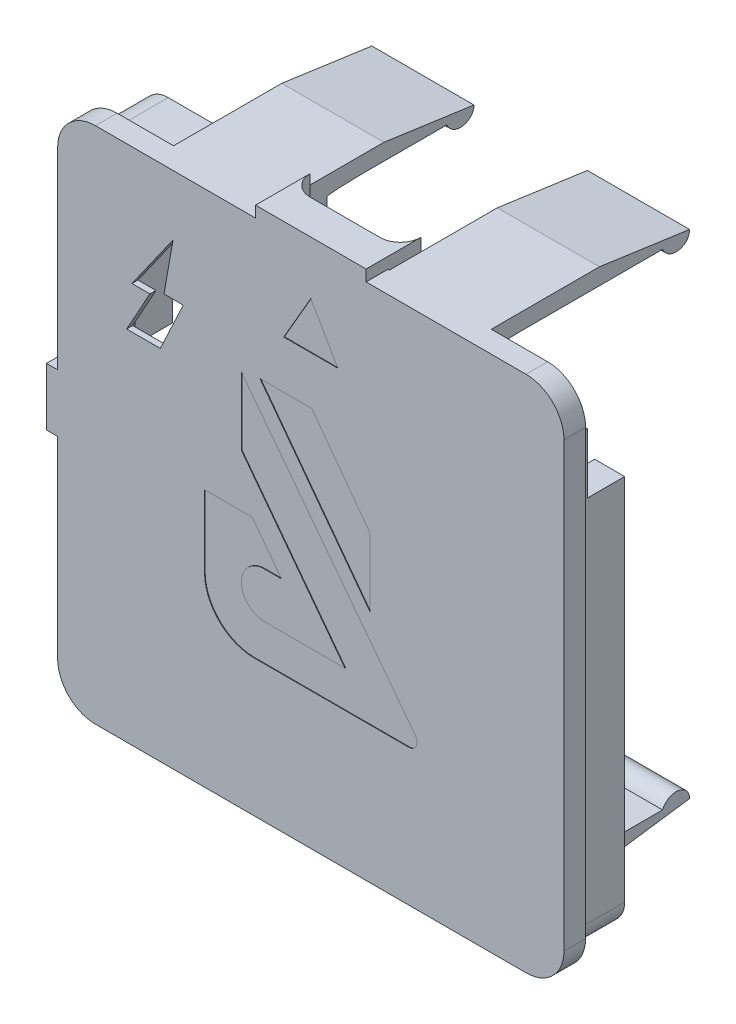
from build123d import *

# Parameters (mm, degrees)
COVER_BASE_DEPTH                             = 1.2
COVER_LIP_DEPTH                              = 0.6
TRIANGLE_INDICATOR_DEPTH                     = 0.05
CHARGE_INDICATOR_HOLE_DEPTH                  = 1.2
LIGHT_PIPE_CUTOUT_SKETCH_W                   = 6.042496398
LIGHT_PIPE_CUTOUT_SKETCH_H                   = 10.123586628
LIGHT_PIPE_CUTOUT_DEPTH                      = 0.7
CHARGE_PORT_SUPPORT_DEPTH                    = 1
POWER_SWITCH_SUPPORT_SKETCH_W                = 0.4
POWER_SWITCH_SUPPORT_SKETCH_H                = 4.8
POWER_SWITCH_SUPPORT_DEPTH                   = 1
INNER_USB_SUPPORT_SKETCH_W                   = 5.8
INNER_USB_SUPPORT_SKETCH_H                   = 6.566666667
INNER_USB_SUPPORT_DEPTH                      = 1.65
OUTER_START                                  = 0.933333333
OUTER_USB_KEY_DEPTH                          = 0.933333333
OUTER_SWITCH_KEY_SKETCH_W                    = 2.2
OUTER_SWITCH_KEY_SKETCH_H                    = 4.8
OUTER_SWITCH_KEY_DEPTH                       = 0.933333333
BATT_CONNECTOR_HOLDER_DEPTH                  = 1.75
MAIN_PCB_SUPPORT_DEPTH                       = 4.85
CLIP_START                                   = -1.8
CLIP_BODY_SKETCH_W                           = 8.5
CLIP_BODY_SKETCH_H                           = 1.366666667
CLIP_BODY_DEPTH                              = 18.3
CLIP_EDGE_DEPTH                              = 8.5
CLIP_SHAVE_DEPTH                             = 8.5
ROUNDING_SHAVE_DEPTH                         = 8.5
CLIP_MIRROR_AT_THE_SECOND_PLANE_COPY_1_S_W   = 8.5
CLIP_MIRROR_AT_THE_SECOND_PLANE_COPY_1_S_H   = 1.366666667
CLIP_MIRROR_AT_THE_SECOND_PLANE_COPY_1_DEPTH = 18.3
CLIP_MIRROR_AT_THE_SECOND_PLANE_COPY_2_DEPTH = 8.5
CLIP_MIRROR_AT_THE_SECOND_PLANE_COPY_3_DEPTH = 8.5
CLIP_MIRROR_AT_THE_SECOND_PLANE_COPY_4_DEPTH = 8.5
CLIP_START_2                                 = -13.22
CLIP_REINFORCEMENT_FILLETS_DEPTH             = 6.3
CLIP_START_3                                 = 6.92
CLIP_REINFORCEMENT_FILLETS_2_DEPTH           = 6.3
CLIP_START_4                                 = -12.34671
CLIP_REINFORCEMENT_FILLETS_3_DEPTH           = 7.62671
CLIP_START_5                                 = 4.72
CLIP_REINFORCEMENT_FILLETS_4_DEPTH           = 7.62671
PRINTED_LOGO_DEPTH                           = 0.05


with BuildPart() as part:
    # Cover Base Sketch → Cover Base (new body)
    with BuildSketch(Plane.XY):
        with BuildLine():
            Line((-21.066666667, -18.416666667), (-21.066666667, 18.416666667))
            ThreePointArc((-21.066666667, 18.416666667), (-20.144053027, 20.644053027), (-17.916666667, 21.566666667))
            Line((-17.916666667, 21.566666667), (17.916666667, 21.566666667))
            ThreePointArc((17.916666667, 21.566666667), (20.144053027, 20.644053027), (21.066666667, 18.416666667))
            Line((21.066666667, 18.416666667), (21.066666667, -18.416666667))
            ThreePointArc((21.066666667, -18.416666667), (20.144053027, -20.644053027), (17.916666667, -21.566666667))
            Line((17.916666667, -21.566666667), (-17.916666667, -21.566666667))
            ThreePointArc((-17.916666667, -21.566666667), (-20.144053027, -20.644053027), (-21.066666667, -18.416666667))
        make_face()
    extrude(amount=-COVER_BASE_DEPTH)

    # Cover lip sketch → Cover Lip (add)
    with BuildSketch(Plane(origin=(0, 0, -1.2), x_dir=(-1, 0, 0), z_dir=(0, 0, -1))):
        with BuildLine():
            Line((-21.066666667, 18.416666667), (-21.066666667, -18.416666667))
            ThreePointArc((-21.066666667, -18.416666667), (-20.144053027, -20.644053027), (-17.916666667, -21.566666667))
            Line((-17.916666667, -21.566666667), (17.916666667, -21.566666667))
            ThreePointArc((17.916666667, -21.566666667), (20.144053027, -20.644053027), (21.066666667, -18.416666667))
            Line((21.066666667, -18.416666667), (21.066666667, 18.416666667))
            ThreePointArc((21.066666667, 18.416666667), (20.144053027, 20.644053027), (17.916666667, 21.566666667))
            Line((17.916666667, 21.566666667), (-17.916666667, 21.566666667))
            ThreePointArc((-17.916666667, 21.566666667), (-20.144053027, 20.644053027), (-21.066666667, 18.416666667))
        make_face()
        with BuildLine():
            Line((17.916666667, 20.566666667), (-17.916666667, 20.566666667))
            ThreePointArc((-17.916666667, 20.566666667), (-19.436946246, 19.936946246), (-20.066666667, 18.416666667))
            Line((-20.066666667, 18.416666667), (-20.066666667, -18.416666667))
            ThreePointArc((-20.066666667, -18.416666667), (-19.436946246, -19.936946246), (-17.916666667, -20.566666667))
            Line((-17.916666667, -20.566666667), (17.916666667, -20.566666667))
            ThreePointArc((17.916666667, -20.566666667), (19.436946246, -19.936946246), (20.066666667, -18.416666667))
            Line((20.066666667, -18.416666667), (20.066666667, 18.416666667))
            ThreePointArc((20.066666667, 18.416666667), (19.436946246, 19.936946246), (17.916666667, 20.566666667))
        make_face(mode=Mode.SUBTRACT)
    extrude(amount=COVER_LIP_DEPTH)

    # Triangle Indicator Sketch → Triangle Indicator (cut)
    with BuildSketch(Plane.XY):
        Polygon((2.25, 14.16955235), (-2.25, 14.16955235), (0, 18.066666667), align=None)
    extrude(amount=-TRIANGLE_INDICATOR_DEPTH, mode=Mode.SUBTRACT)

    # Charge Indicator Hole Sketch → Charge Indicator Hole (cut)
    with BuildSketch(Plane.XY):
        Polygon((-12.521248199, 8.211793314), (-15.321248199, 8.211793314), (-13.384756526, 11.711793314), (-14.884756526, 11.711793314), (-11.461694847, 16.561793314), (-12.215243474, 12.288206686), (-10.615243474, 12.288206686), align=None)
    extrude(amount=-CHARGE_INDICATOR_HOLE_DEPTH, mode=Mode.SUBTRACT)

    # Light Pipe Cutout Sketch → Light Pipe Cutout (cut)
    with BuildSketch(Plane(origin=(0, 0, -1.2), x_dir=(-1, 0, 0), z_dir=(0, 0, -1))):
        with Locations((12.8, 12)):
            Rectangle(LIGHT_PIPE_CUTOUT_SKETCH_W, LIGHT_PIPE_CUTOUT_SKETCH_H)
    extrude(amount=-LIGHT_PIPE_CUTOUT_DEPTH, mode=Mode.SUBTRACT)

    # Charge Port Support Sketch → Charge Port Support (add)
    with BuildSketch(Plane(origin=(0, 21.566666667, 0), x_dir=(1, 0, 0), z_dir=(0, 1, 0))):
        with BuildLine():
            Line((4.6, 4.55), (4.6, 1.8))
            Line((4.6, 1.8), (-4.6, 1.8))
            Line((-4.6, 1.8), (-4.6, 4.55))
            ThreePointArc((-4.6, 4.55), (-4.102081528, 3.347918472), (-2.9, 2.85))
            Line((-2.9, 2.85), (2.9, 2.85))
            ThreePointArc((2.9, 2.85), (4.102081528, 3.347918472), (4.6, 4.55))
        make_face()
    extrude(amount=-CHARGE_PORT_SUPPORT_DEPTH)

    # Power Switch Support Sketch → Power Switch Support (add)
    with BuildSketch(Plane.ZY.offset(21.066666667)):
        with Locations((-2, 0)):
            Rectangle(POWER_SWITCH_SUPPORT_SKETCH_W, POWER_SWITCH_SUPPORT_SKETCH_H)
    extrude(amount=-POWER_SWITCH_SUPPORT_DEPTH)

    # Inner USB Support Sketch → Inner USB Support (add)
    with BuildSketch(Plane(origin=(0, 0, -1.2), x_dir=(-1, 0, 0), z_dir=(0, 0, -1))):
        with Locations((0, 17.283333333)):
            Rectangle(INNER_USB_SUPPORT_SKETCH_W, INNER_USB_SUPPORT_SKETCH_H)
    extrude(amount=INNER_USB_SUPPORT_DEPTH)

    # Outer USB Key Sketch → Outer USB Key (add)
    with BuildSketch(Plane(origin=(0, 21.566666667, 0), x_dir=(1, 0, 0), z_dir=(0, 1, 0)).offset(OUTER_START)):
        with BuildLine():
            Line((-4.6, 4.55), (-4.6, 1.8))
            Line((-4.6, 1.8), (-4.6, 0))
            Line((-4.6, 0), (4.6, 0))
            Line((4.6, 0), (4.6, 1.8))
            Line((4.6, 1.8), (4.6, 4.55))
            ThreePointArc((4.6, 4.55), (4.102081528, 3.347918472), (2.9, 2.85))
            Line((2.9, 2.85), (-2.9, 2.85))
            ThreePointArc((-2.9, 2.85), (-4.102081528, 3.347918472), (-4.6, 4.55))
        make_face()
    extrude(amount=-OUTER_USB_KEY_DEPTH)

    # Outer Switch Key Sketch → Outer Switch Key (add)
    with BuildSketch(Plane.ZY.offset(21.066666667)):
        with Locations((-1.1, 0)):
            Rectangle(OUTER_SWITCH_KEY_SKETCH_W, OUTER_SWITCH_KEY_SKETCH_H)
    extrude(amount=OUTER_SWITCH_KEY_DEPTH)

    # Batt Connector Holder Sketch → Batt Connector Holder (add)
    with BuildSketch(Plane(origin=(0, 0, -1.2), x_dir=(-1, 0, 0), z_dir=(0, 0, -1))):
        Polygon((-14.875, 17.25), (-19.375, 17.25), (-20.066666667, 17.25), (-20.066666667, 12.25), (-19.375, 12.25), (-14.875, 12.25), align=None)
    extrude(amount=BATT_CONNECTOR_HOLDER_DEPTH)

    # Main PCB Support Sketch → Main PCB Support (add)
    with BuildSketch(Plane(origin=(0, 0, -1.2), x_dir=(-1, 0, 0), z_dir=(0, 0, -1))):
        with BuildLine():
            Line((17.566666667, -4.495), (17.566666667, -15.916666667))
            ThreePointArc((17.566666667, -15.916666667), (16.936946246, -17.436946246), (15.416666667, -18.066666667))
            Line((15.416666667, -18.066666667), (6.92, -18.066666667))
            Line((6.92, -18.066666667), (6.92, -20.566666667))
            Line((6.92, -20.566666667), (17.916666667, -20.566666667))
            ThreePointArc((17.916666667, -20.566666667), (19.436946246, -19.936946246), (20.066666667, -18.416666667))
            Line((20.066666667, -18.416666667), (20.066666667, -4.495))
            Line((20.066666667, -4.495), (17.566666667, -4.495))
        make_face()
        with BuildLine():
            Line((17.566666667, 4.495), (20.066666667, 4.495))
            Line((20.066666667, 4.495), (20.066666667, 18.416666667))
            ThreePointArc((20.066666667, 18.416666667), (19.436946246, 19.936946246), (17.916666667, 20.566666667))
            Line((17.916666667, 20.566666667), (4.72, 20.566666667))
            Line((4.72, 20.566666667), (4.72, 18.066666667))
            Line((4.72, 18.066666667), (15.416666667, 18.066666667))
            ThreePointArc((15.416666667, 18.066666667), (16.936946246, 17.436946246), (17.566666667, 15.916666667))
            Line((17.566666667, 15.916666667), (17.566666667, 4.495))
        make_face()
        with BuildLine():
            Line((-20.066666667, 12.25), (-17.566666667, 12.25))
            Line((-17.566666667, 12.25), (-17.566666667, -15.916666667))
            ThreePointArc((-17.566666667, -15.916666667), (-16.936946246, -17.436946246), (-15.416666667, -18.066666667))
            Line((-15.416666667, -18.066666667), (-6.92, -18.066666667))
            Line((-6.92, -18.066666667), (-6.92, -20.566666667))
            Line((-6.92, -20.566666667), (-17.916666667, -20.566666667))
            ThreePointArc((-17.916666667, -20.566666667), (-19.436946246, -19.936946246), (-20.066666667, -18.416666667))
            Line((-20.066666667, -18.416666667), (-20.066666667, 12.25))
        make_face()
    extrude(amount=MAIN_PCB_SUPPORT_DEPTH)

    # Clip Body Sketch → Clip Body (add)
    with BuildSketch(Plane(origin=(0, 0, -1.8), x_dir=(-1, 0, 0), z_dir=(0, 0, -1)).offset(CLIP_START)):
        with Locations((8.97, 20.883333334)):
            Rectangle(CLIP_BODY_SKETCH_W, CLIP_BODY_SKETCH_H)
    clip_body = extrude(amount=CLIP_BODY_DEPTH)

    # Clip Edge Sketch → Clip Edge (add)
    with BuildSketch(Plane(origin=(-4.72, 0, 0), x_dir=(0, 0, -1), z_dir=(1, 0, 0))):
        with BuildLine():
            Line((18.3, 20.2), (16.05, 20.2))
            ThreePointArc((16.05, 20.2), (17.175, 19.45), (18.3, 20.2))
        make_face()
    clip_edge = extrude(amount=-CLIP_EDGE_DEPTH)

    # Clip shave sketch → Clip shave (cut)
    with BuildSketch(Plane.ZY.offset(13.22)):
        Polygon((-18.3, 20.508333333), (-10.8, 21.566666667), (-18.3, 21.566666667), align=None)
    clip_shave = extrude(amount=-CLIP_SHAVE_DEPTH, mode=Mode.SUBTRACT)

    # Rounding Shave Sketch → Rounding Shave (cut)
    with BuildSketch(Plane.ZY.offset(13.22)):
        with BuildLine():
            Line((-17.175, 19.45), (-17.175, 19.43))
            Line((-17.175, 19.43), (-18.32, 19.43))
            Line((-18.32, 19.43), (-18.32, 20.508333333))
            Line((-18.32, 20.508333333), (-18.3, 20.508333333))
            ThreePointArc((-18.3, 20.508333333), (-17.96621101, 19.736048664), (-17.175, 19.45))
        make_face()
    rounding_shave = extrude(amount=-ROUNDING_SHAVE_DEPTH, mode=Mode.SUBTRACT)

    # Clip Mirror: Clip Body, Clip Edge, Clip shave, Rounding Shave across plane
    add(clip_body.mirror(Plane(origin=(0, 0, 0), x_dir=(0, 0, 1), z_dir=(1, 0, 0))))
    add(clip_edge.mirror(Plane(origin=(0, 0, 0), x_dir=(0, 0, 1), z_dir=(1, 0, 0))))
    add(clip_shave.mirror(Plane(origin=(0, 0, 0), x_dir=(0, 0, 1), z_dir=(1, 0, 0))), mode=Mode.SUBTRACT)
    add(rounding_shave.mirror(Plane(origin=(0, 0, 0), x_dir=(0, 0, 1), z_dir=(1, 0, 0))), mode=Mode.SUBTRACT)

    # Clip Mirror at the second plane: Clip Body, Clip Edge, Clip shave, Rounding Shave across plane
    add(clip_body.mirror(Plane.ZX))
    add(clip_edge.mirror(Plane.ZX))
    add(clip_shave.mirror(Plane.ZX), mode=Mode.SUBTRACT)
    add(rounding_shave.mirror(Plane.ZX), mode=Mode.SUBTRACT)

    # Clip Mirror at the second plane copy 1 s → Clip Mirror at the second plane copy 1 (add)
    with BuildSketch(Plane(origin=(0, 0, -1.8), x_dir=(1, 0, 0), z_dir=(0, 0, -1)).offset(CLIP_START)):
        with Locations((8.97, 20.883333334)):
            Rectangle(CLIP_MIRROR_AT_THE_SECOND_PLANE_COPY_1_S_W, CLIP_MIRROR_AT_THE_SECOND_PLANE_COPY_1_S_H)
    extrude(amount=CLIP_MIRROR_AT_THE_SECOND_PLANE_COPY_1_DEPTH)

    # Clip Mirror at the second plane copy 2 s → Clip Mirror at the second plane copy 2 (add)
    with BuildSketch(Plane(origin=(4.72, 0, 0), x_dir=(0, 0, -1), z_dir=(-1, 0, 0))):
        with BuildLine():
            Line((18.3, 20.2), (16.05, 20.2))
            ThreePointArc((16.05, 20.2), (17.175, 19.45), (18.3, 20.2))
        make_face()
    extrude(amount=-CLIP_MIRROR_AT_THE_SECOND_PLANE_COPY_2_DEPTH)

    # Clip Mirror at the second plane copy 3 s → Clip Mirror at the second plane copy 3 (cut)
    with BuildSketch(Plane(origin=(13.22, 0, 0), x_dir=(0, 0, 1), z_dir=(1, 0, 0))):
        Polygon((-18.3, 20.508333333), (-10.8, 21.566666667), (-18.3, 21.566666667), align=None)
    extrude(amount=-CLIP_MIRROR_AT_THE_SECOND_PLANE_COPY_3_DEPTH, mode=Mode.SUBTRACT)

    # Clip Mirror at the second plane copy 4 s → Clip Mirror at the second plane copy 4 (cut)
    with BuildSketch(Plane(origin=(13.22, 0, 0), x_dir=(0, 0, 1), z_dir=(1, 0, 0))):
        with BuildLine():
            Line((-17.175, 19.45), (-17.175, 19.43))
            Line((-17.175, 19.43), (-18.32, 19.43))
            Line((-18.32, 19.43), (-18.32, 20.508333333))
            Line((-18.32, 20.508333333), (-18.3, 20.508333333))
            ThreePointArc((-18.3, 20.508333333), (-17.96621101, 19.736048664), (-17.175, 19.45))
        make_face()
    extrude(amount=-CLIP_MIRROR_AT_THE_SECOND_PLANE_COPY_4_DEPTH, mode=Mode.SUBTRACT)

    # Clip Reinforcement Fillets: read off the stored shape, not the designer's step
    # Clip Reinforcement Fillets outline → Clip Reinforcement Fillets (add)
    with BuildSketch(Plane.YZ.offset(CLIP_START_2)):
        with BuildLine():
            add(Edge.make_bspline(
                [(-20, -6.05), (-20.2, -6.05), (-20.2, -9.05)],
                knots=[0, 0, 0, 1, 1, 1], degree=2, weights=[1, 0.707106781, 1]))
            Line((-20, -6.05), (-20.2, -6.05))
            Line((-20.2, -6.05), (-20.2, -9.05))
        make_face()
        with BuildLine():
            Line((20.2, -6.05), (20, -6.05))
            add(Edge.make_bspline(
                [(20, -6.05), (20.2, -6.05), (20.2, -9.05)],
                knots=[0, 0, 0, 1, 1, 1], degree=2, weights=[1, 0.707106781, 1]))
            Line((20.2, -9.05), (20.2, -6.05))
        make_face()
    extrude(amount=CLIP_REINFORCEMENT_FILLETS_DEPTH)

    # Clip Reinforcement Fillets 2 outline → Clip Reinforcement Fillets 2 (add)
    with BuildSketch(Plane.YZ.offset(CLIP_START_3)):
        with BuildLine():
            add(Edge.make_bspline(
                [(-20, -6.05), (-20.2, -6.05), (-20.2, -9.05)],
                knots=[0, 0, 0, 1, 1, 1], degree=2, weights=[1, 0.707106781, 1]))
            Line((-20, -6.05), (-20.2, -6.05))
            Line((-20.2, -6.05), (-20.2, -9.05))
        make_face()
        with BuildLine():
            Line((20.2, -1.2), (20, -1.2))
            add(Edge.make_bspline(
                [(20.2, -4.2), (20.2, -1.2), (20, -1.2)],
                knots=[0, 0, 0, 1, 1, 1], degree=2, weights=[1, 0.707106781, 1]))
            Line((20.2, -4.2), (20.2, -1.2))
        make_face()
    extrude(amount=CLIP_REINFORCEMENT_FILLETS_2_DEPTH)

    # Clip Reinforcement Fillets 3 outline → Clip Reinforcement Fillets 3 (add)
    with BuildSketch(Plane.YZ.offset(CLIP_START_4)):
        with BuildLine():
            Line((-20.2, -1.2), (-20.2, -4.2))
            add(Edge.make_bspline(
                [(-20.2, -4.2), (-20.2, -1.2), (-20, -1.2)],
                knots=[0, 0, 0, 1, 1, 1], degree=2, weights=[1, 0.707106781, 1]))
            Line((-20, -1.2), (-20.2, -1.2))
        make_face()
        with BuildLine():
            Line((20.2, -6.05), (20, -6.05))
            add(Edge.make_bspline(
                [(20, -6.05), (20.2, -6.05), (20.2, -9.05)],
                knots=[0, 0, 0, 1, 1, 1], degree=2, weights=[1, 0.707106781, 1]))
            Line((20.2, -9.05), (20.2, -6.05))
        make_face()
    extrude(amount=CLIP_REINFORCEMENT_FILLETS_3_DEPTH)

    # Clip Reinforcement Fillets 4 outline → Clip Reinforcement Fillets 4 (add)
    with BuildSketch(Plane.YZ.offset(CLIP_START_5)):
        with BuildLine():
            Line((-20.2, -1.2), (-20.2, -4.2))
            add(Edge.make_bspline(
                [(-20.2, -4.2), (-20.2, -1.2), (-20, -1.2)],
                knots=[0, 0, 0, 1, 1, 1], degree=2, weights=[1, 0.707106781, 1]))
            Line((-20, -1.2), (-20.2, -1.2))
        make_face()
        with BuildLine():
            Line((20.2, -1.2), (20, -1.2))
            add(Edge.make_bspline(
                [(20.2, -4.2), (20.2, -1.2), (20, -1.2)],
                knots=[0, 0, 0, 1, 1, 1], degree=2, weights=[1, 0.707106781, 1]))
            Line((20.2, -4.2), (20.2, -1.2))
        make_face()
    extrude(amount=CLIP_REINFORCEMENT_FILLETS_4_DEPTH)

    # Printed Logo Sketch → Printed Logo (cut)
    with BuildSketch(Plane.XY):
        Polygon((-4.23250109, 10.189718106), (0.08549891, 10.189718106), (4.94324891, 3.617468106), (4.94324891, -2.065781894), align=None)
        with BuildLine():
            Line((-2.47741276, -3.351423184), (-2.439184172, -3.351423184))
            Line((-2.439184172, -3.351423184), (-2.462247295, -3.320935198))
            Line((-2.462247295, -3.320935198), (-4.879342923, -0.125688064))
            Line((-4.879342923, -0.125688064), (-8.843997975, -0.125688064))
            Line((-8.843997975, -0.125688064), (-8.843997975, -6.069504139))
            ThreePointArc((-8.843997975, -6.069504139), (-7.637215244, -8.982935375), (-4.723784007, -10.189718106))
            Line((-4.723784007, -10.189718106), (8.142252025, -10.189718106))
            ThreePointArc((8.142252025, -10.189718106), (8.771289821, -9.799032969), (8.699915402, -9.061992186))
            Line((8.699915402, -9.061992186), (-5.758948873, 9.866548189))
            Line((-5.758948873, 9.866548189), (-5.758948873, 4.222033189))
            Line((-5.758948873, 4.222033189), (2.840710077, -7.146170579))
            Line((2.840710077, -7.146170579), (-3.873628607, -7.146170579))
            ThreePointArc((-3.873628607, -7.146170579), (-5.771002305, -5.248796882), (-3.873628607, -3.351423184))
            Line((-3.873628607, -3.351423184), (-2.47741276, -3.351423184))
        make_face()
    extrude(amount=-PRINTED_LOGO_DEPTH, mode=Mode.SUBTRACT)


solid = part.part
